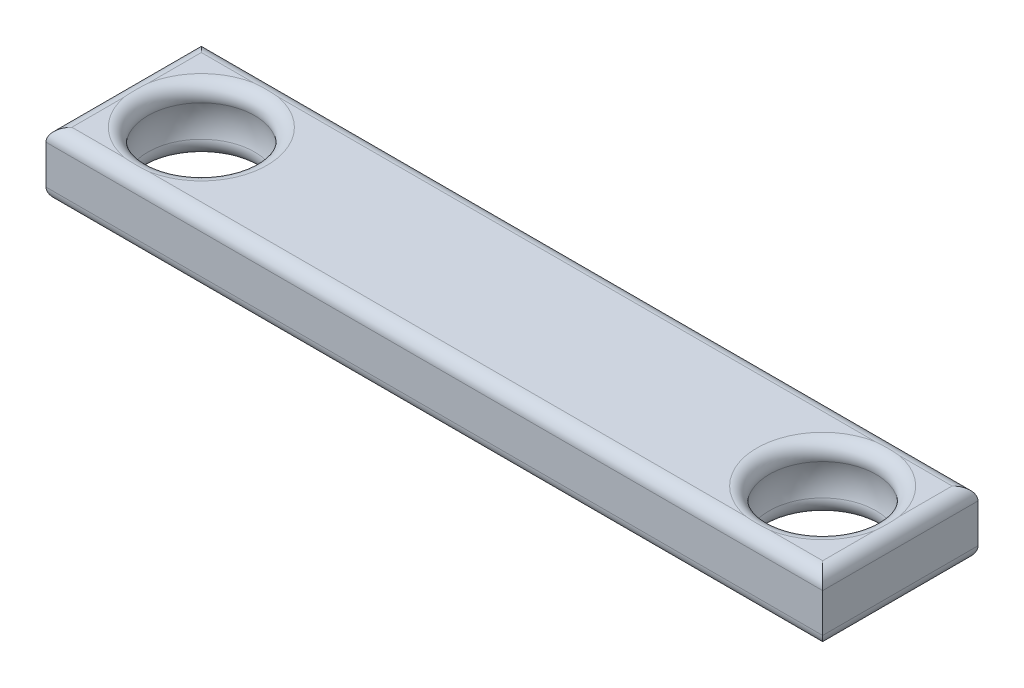
from build123d import *

# Parameters (mm, degrees)
SKETCH1_W           = 60
SKETCH1_H           = 5
BOSS_EXTRUDE1_DEPTH = 6
FILLET1_R           = 1


with BuildPart() as part:
    # Sketch1 → Boss-Extrude1 (new, symmetric)
    with BuildSketch(Plane.XY):
        Rectangle(SKETCH1_W, SKETCH1_H)
    extrude(amount=BOSS_EXTRUDE1_DEPTH, both=True)

    # Sketch2 → Cut-Revolve1 (revolve, cut)
    with BuildSketch(Plane.XY):
        with BuildLine():
            Line((-24, 2.5), (-24, -2.5))
            Line((-24, -2.5), (-27.5, -2.5))
            ThreePointArc((-27.5, -2.5), (-28.301162634, 0), (-27.5, 2.5))
            Line((-27.5, 2.5), (-24, 2.5))
        make_face()
    cut_revolve1 = revolve(axis=Axis((-24, 2.5, 0), (0, -1, 0)), mode=Mode.SUBTRACT)

    # Mirror1: Cut-Revolve1 across plane
    add(cut_revolve1.mirror(Plane(origin=(0, 0, 0), x_dir=(0, 0, 1), z_dir=(1, 0, 0))), mode=Mode.SUBTRACT)

    # Fillet1
    # the kernel refuses this fillet: 1 mm, written as the material it takes off along each edge
    with BuildSketch(Plane(origin=(-24, 2.5, 0), x_dir=(-1, 0, 0), z_dir=(0, 0, 1))) as fillet1_piece_1:
        with BuildLine():
            CenterArc((5.084518194, 1), FILLET1_R, 163.563244845, 106.436755155)
            ThreePointArc((4.125385539, 1.282956797), (3.866279955, 0.615356981), (3.5, 0))
            Line((3.5, 0), (5.084518194, 0))
        make_face()
    revolve(axis=Axis((-24, 2.5, 0), (0, -1, 0)), mode=Mode.SUBTRACT)
    with BuildSketch(Plane(origin=(-24, -2.5, 0), x_dir=(-1, 0, 0), z_dir=(0, 0, 1))) as fillet1_piece_2:
        with BuildLine():
            CenterArc((5.084518194, -1), FILLET1_R, 90, 106.436755155)
            Line((5.084518194, 0), (3.5, 0))
            ThreePointArc((3.5, 0), (3.866279955, -0.615356981), (4.125385539, -1.282956797))
        make_face()
    revolve(axis=Axis((-24, -2.5, 0), (0, -1, 0)), mode=Mode.SUBTRACT)
    with BuildSketch(Plane(origin=(32.5, -2.5, 6), x_dir=(0, 1, 0), z_dir=(-1, 0, 0)), Plane(origin=(-32.5, 2.5, -6), x_dir=(0, 0, 1), z_dir=(1, 0, 0))) as fillet1_piece_3:
        with BuildLine():
            CenterArc((FILLET1_R, FILLET1_R), FILLET1_R, 180, 90)
            Line((0, FILLET1_R), (0, 0))
            Line((0, 0), (FILLET1_R, 0))
        make_face()
    extrude(amount=65, mode=Mode.SUBTRACT)
    with BuildSketch(Plane(origin=(24, 2.5, 0), x_dir=(1, 0, 0), z_dir=(0, 0, 1))) as fillet1_piece_4:
        with BuildLine():
            CenterArc((5.084518194, -1), FILLET1_R, 90, 106.436755155)
            ThreePointArc((4.125385539, -1.282956797), (3.866279955, -0.615356981), (3.5, 0))
            Line((3.5, 0), (5.084518194, 0))
        make_face()
    revolve(axis=Axis((24, 2.5, 0), (0, 1, 0)), mode=Mode.SUBTRACT)
    with BuildSketch(Plane(origin=(24, -2.5, 0), x_dir=(1, 0, 0), z_dir=(0, 0, 1))) as fillet1_piece_5:
        with BuildLine():
            CenterArc((5.084518194, 1), FILLET1_R, 163.563244845, 106.436755155)
            Line((5.084518194, 0), (3.5, 0))
            ThreePointArc((3.5, 0), (3.866279955, 0.615356981), (4.125385539, 1.282956797))
        make_face()
    revolve(axis=Axis((24, -2.5, 0), (0, 1, 0)), mode=Mode.SUBTRACT)
    with BuildSketch(Plane(origin=(32.5, -2.5, -6), x_dir=(0, 1, 0), z_dir=(-1, 0, 0)), Plane(origin=(-32.5, 2.5, 6), x_dir=(0, 0, -1), z_dir=(1, 0, 0))) as fillet1_piece_6:
        with BuildLine():
            CenterArc((FILLET1_R, -FILLET1_R), FILLET1_R, 90, 90)
            Line((0, -FILLET1_R), (0, 0))
            Line((0, 0), (FILLET1_R, 0))
        make_face()
    extrude(amount=65, mode=Mode.SUBTRACT)
    with BuildSketch(Plane(origin=(30, -2.5, 8.5), x_dir=(0, 1, 0), z_dir=(0, 0, -1)), Plane(origin=(-30, -2.5, -8.5), x_dir=(0, 1, 0), z_dir=(0, 0, 1)), Plane(origin=(-30, 2.5, -8.5), x_dir=(1, 0, 0), z_dir=(0, 0, 1)), Plane(origin=(30, 2.5, 8.5), x_dir=(-1, 0, 0), z_dir=(0, 0, -1))) as fillet1_piece_7:
        with BuildLine():
            CenterArc((FILLET1_R, -FILLET1_R), FILLET1_R, 90, 90)
            Line((0, -FILLET1_R), (0, 0))
            Line((0, 0), (FILLET1_R, 0))
        make_face()
    extrude(amount=17, mode=Mode.SUBTRACT)


solid = part.part
